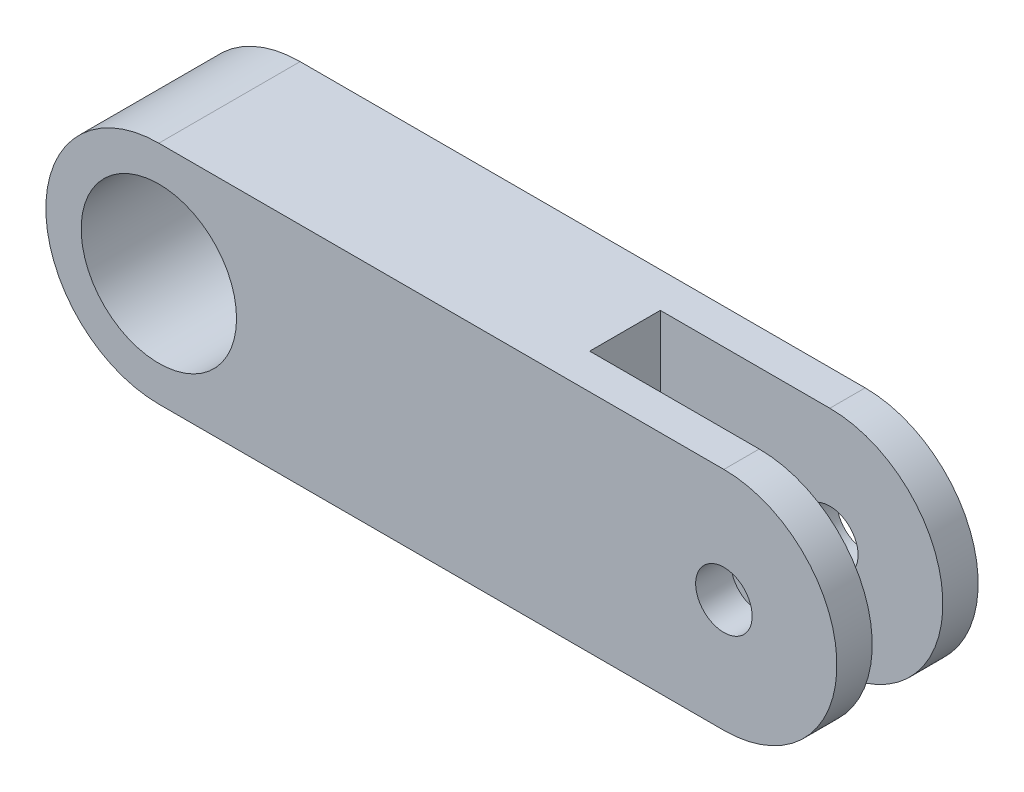
from build123d import *

# Parameters (mm, degrees)
SKETCH1_R           = 2.75
SKETCH1_R_2         = 1
BOSS_EXTRUDE1_DEPTH = 2.5
SKETCH5_W           = 10
SKETCH5_H           = 8
CUT_EXTRUDE1_DEPTH  = 1.25


with BuildPart() as part:
    # Sketch1 → Boss-Extrude1 (new, symmetric)
    with BuildSketch(Plane.XY):
        with BuildLine():
            Line((-10, 4), (10, 4))
            ThreePointArc((10, 4), (14, 0), (10, -4))
            Line((10, -4), (-10, -4))
            ThreePointArc((-10, -4), (-14, 0), (-10, 4))
        make_face()
        with Locations((-10, 0)):
            Circle(SKETCH1_R, mode=Mode.SUBTRACT)
        with Locations((10, 0)):
            Circle(SKETCH1_R_2, mode=Mode.SUBTRACT)
    extrude(amount=BOSS_EXTRUDE1_DEPTH, both=True)

    # Sketch5 → Cut-Extrude1 (cut, symmetric)
    with BuildSketch(Plane.XY):
        with Locations((9, 0)):
            Rectangle(SKETCH5_W, SKETCH5_H)
    extrude(amount=CUT_EXTRUDE1_DEPTH, both=True, mode=Mode.SUBTRACT)


solid = part.part
